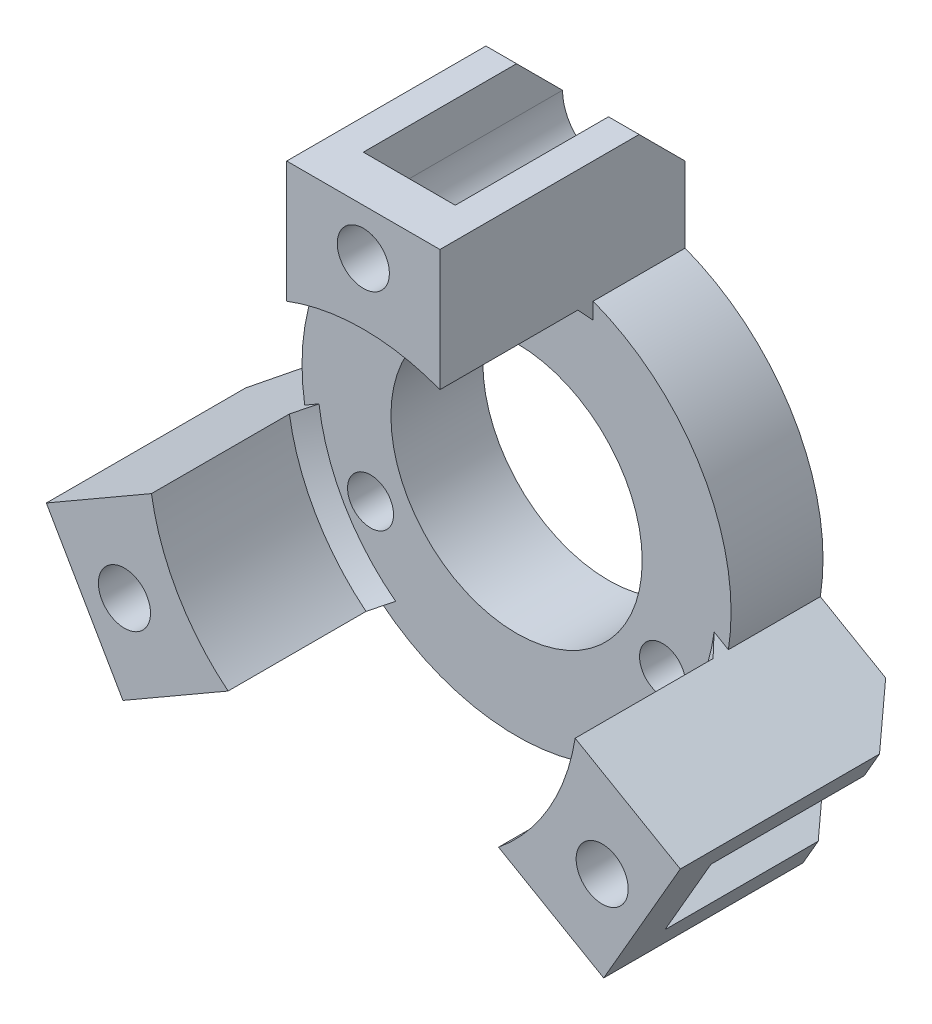
from build123d import *

# Parameters (mm, degrees)
SKETCH_1_R          = 14
SKETCH_1_R_2        = 8.2
EXTRUDE_1_DEPTH     = 6
EXTRUDE_2_DEPTH     = 16
SKETCH_3_R          = 1.7
CUT_EXTRUDE_1_DEPTH = 34.540015912
SKETCH_4_R          = 1.5
CUT_EXTRUDE_2_DEPTH = 34.540015912
CUT_EXTRUDE_3_DEPTH = 13
CHAMFER_1_SIZE      = 3
CHAMFER_2_SIZE      = 1


with BuildPart() as part:
    # 草圖1 → 填料-伸長1 (new body)
    with BuildSketch(Plane.XY):
        Circle(SKETCH_1_R)
        Circle(SKETCH_1_R_2, mode=Mode.SUBTRACT)
    extrude(amount=EXTRUDE_1_DEPTH)

    # 草圖2 → 填料-伸長2 (add)
    with BuildSketch(Plane.XY):
        with BuildLine():
            Line((20.686533479, -6.169872981), (13.824751653, -2.208221396))
            ThreePointArc((13.824751653, -2.208221396), (12.124355653, -7), (8.824751653, -10.868475434))
            Line((8.824751653, -10.868475434), (15.686533479, -14.830127019))
            Line((15.686533479, -14.830127019), (20.686533479, -6.169872981))
        make_face()
        with BuildLine():
            Line((-5, 21), (5, 21))
            Line((5, 21), (5, 13.076696831))
            ThreePointArc((5, 13.076696831), (0, 14), (-5, 13.076696831))
            Line((-5, 13.076696831), (-5, 21))
        make_face()
        with BuildLine():
            Line((-15.686533479, -14.830127019), (-8.824751653, -10.868475434))
            ThreePointArc((-8.824751653, -10.868475434), (-12.124355653, -7), (-13.824751653, -2.208221396))
            Line((-13.824751653, -2.208221396), (-20.686533479, -6.169872981))
            Line((-20.686533479, -6.169872981), (-15.686533479, -14.830127019))
        make_face()
    extrude(amount=EXTRUDE_2_DEPTH)

    # 草圖3 → 除料-伸長1 (cut, through all)
    with BuildSketch(Plane.XY.offset(16)):
        with Locations((0, 18)):
            Circle(SKETCH_3_R)
        with Locations((15.588457268, -9)):
            Circle(SKETCH_3_R)
        with Locations((-15.588457268, -9)):
            Circle(SKETCH_3_R)
    extrude(amount=-CUT_EXTRUDE_1_DEPTH, mode=Mode.SUBTRACT)

    # 草圖4 → 除料-伸長2 (cut, through all)
    with BuildSketch(Plane(origin=(0, 0, 0), x_dir=(-1, 0, 0), z_dir=(0, 0, -1))):
        with Locations((0, 11)):
            Circle(SKETCH_4_R)
        with Locations((9.526279442, -5.5)):
            Circle(SKETCH_4_R)
        with Locations((-9.526279442, -5.5)):
            Circle(SKETCH_4_R)
    extrude(amount=-CUT_EXTRUDE_2_DEPTH, mode=Mode.SUBTRACT)

    # 草圖5 → 除料-伸長3 (cut)
    with BuildSketch(Plane(origin=(0, 0, 0), x_dir=(-1, 0, 0), z_dir=(0, 0, -1))):
        with BuildLine():
            Line((17.088457268, -6.401923789), (19.686533479, -7.901923789))
            Line((19.686533479, -7.901923789), (16.686533479, -13.098076211))
            Line((16.686533479, -13.098076211), (14.088457268, -11.598076211))
            ThreePointArc((14.088457268, -11.598076211), (12.990381057, -7.5), (17.088457268, -6.401923789))
        make_face()
        with BuildLine():
            Line((-3, 18), (-3, 21))
            Line((-3, 21), (3, 21))
            Line((3, 21), (3, 18))
            ThreePointArc((3, 18), (0, 15), (-3, 18))
        make_face()
        with BuildLine():
            Line((-14.088457268, -11.598076211), (-16.686533479, -13.098076211))
            Line((-16.686533479, -13.098076211), (-19.686533479, -7.901923789))
            Line((-19.686533479, -7.901923789), (-17.088457268, -6.401923789))
            ThreePointArc((-17.088457268, -6.401923789), (-12.990381057, -7.5), (-14.088457268, -11.598076211))
        make_face()
    extrude(amount=-CUT_EXTRUDE_3_DEPTH, mode=Mode.SUBTRACT)

    # 導角1
    chamfer_1_edges = [part.edges().sort_by_distance(p)[0] for p in [
        (4, 21, 0),
        (-4, 21, 0),
        (-20.186533479, -7.035898385, 0),
        (-16.186533479, -13.964101615, 0),
        (20.186533479, -7.035898385, 0),
        (16.186533479, -13.964101615, 0),
    ]]
    chamfer(chamfer_1_edges, length=CHAMFER_1_SIZE)

    # 導角2
    # the kernel refuses this chamfer: 1 mm, written as the material it adds along each edge
    with BuildSketch(Plane(origin=(0, 0, 6), x_dir=(0.4779177917946843, -0.8784045675462375, 0), z_dir=(-0.8784045675462375, -0.4779177917946843, 0))) as chamfer_2_piece_1_section:
        Polygon((14 - CHAMFER_2_SIZE, 0), (14, CHAMFER_2_SIZE), (14, 0), align=None)
    chamfer_2_piece_1 = revolve(axis=Axis((0, 0, 6), (0, 0, 1)), revolution_arc=62.901004407, mode=Mode.PRIVATE)
    chamfer_2_piece_1 = split(chamfer_2_piece_1, bisect_by=Plane(origin=(14.060598585, -2.344387686, 6.333230846), z_dir=(-0.5000000000000002, -0.8660254037844386, 0)), keep=Keep.TOP, mode=Mode.PRIVATE)
    chamfer_2_piece_1 = split(chamfer_2_piece_1, bisect_by=Plane(origin=(9.060598585, -11.004641724, 6.333230846), z_dir=(0.49999999999999956, 0.8660254037844389, 0)), keep=Keep.TOP, mode=Mode.PRIVATE)
    add(chamfer_2_piece_1)
    with BuildSketch(Plane(origin=(0, 0, 6), x_dir=(-0.9996795661926668, 0.025313335158395317, 0), z_dir=(0.025313335158395317, 0.9996795661926668, 0))) as chamfer_2_piece_2_section:
        Polygon((14 - CHAMFER_2_SIZE, 0), (14, CHAMFER_2_SIZE), (14, 0), align=None)
    chamfer_2_piece_2 = revolve(axis=Axis((0, 0, 6), (0, 0, 1)), revolution_arc=62.901004407, mode=Mode.PRIVATE)
    chamfer_2_piece_2 = split(chamfer_2_piece_2, bisect_by=Plane(origin=(-14.060598585, -2.344387686, 6.333230846), z_dir=(0.5000000000000009, -0.8660254037844383, 0)), keep=Keep.TOP, mode=Mode.PRIVATE)
    chamfer_2_piece_2 = split(chamfer_2_piece_2, bisect_by=Plane(origin=(-9.060598585, -11.004641724, 6.333230846), z_dir=(-0.5000000000000003, 0.8660254037844387, 0)), keep=Keep.TOP, mode=Mode.PRIVATE)
    add(chamfer_2_piece_2)
    with BuildSketch(Plane(origin=(0, 0, 6), x_dir=(0.5217617743979716, 0.853091232387885, 0), z_dir=(0.853091232387885, -0.5217617743979716, 0))) as chamfer_2_piece_3_section:
        Polygon((14, CHAMFER_2_SIZE), (14 - CHAMFER_2_SIZE, 0), (14, 0), align=None)
    chamfer_2_piece_3 = revolve(axis=Axis((0, 0, 6), (0, 0, 1)), revolution_arc=62.901004407, mode=Mode.PRIVATE)
    chamfer_2_piece_3 = split(chamfer_2_piece_3, bisect_by=Plane(origin=(5, 13.34902941, 6.333230846), z_dir=(-1, 0, 0)), keep=Keep.TOP, mode=Mode.PRIVATE)
    chamfer_2_piece_3 = split(chamfer_2_piece_3, bisect_by=Plane(origin=(-5, 13.34902941, 6.333230846), z_dir=(1, 0, 0)), keep=Keep.TOP, mode=Mode.PRIVATE)
    add(chamfer_2_piece_3)


solid = part.part
